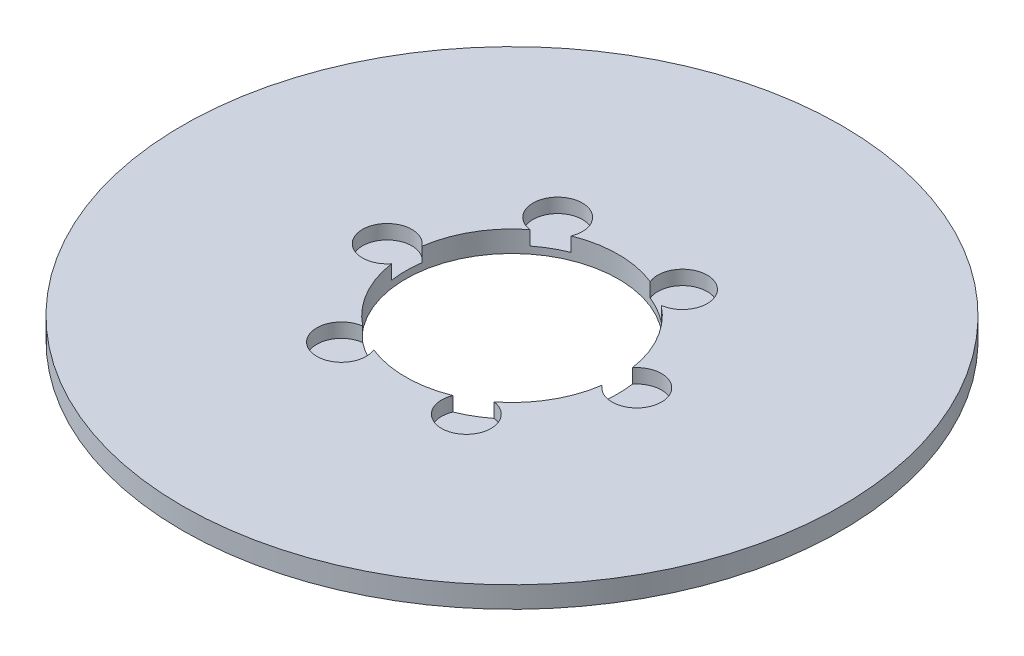
from build123d import *

# Parameters (mm, degrees)
SKETCH1_R           = 77.5
BOSS_EXTRUDE1_DEPTH = 5
SKETCH2_R           = 25
CUT_EXTRUDE1_DEPTH  = 110.715541287
SKETCH3_R           = 5.816818437
CUT_EXTRUDE2_DEPTH  = 3.356195956
CIRPATTERN1_COUNT   = 6


with BuildPart() as part:
    # Sketch1 → Boss-Extrude1 (new body)
    with BuildSketch(Plane(origin=(0, 0, 0), x_dir=(1, 0, 0), z_dir=(0, 1, 0))):
        Circle(SKETCH1_R)
    extrude(amount=BOSS_EXTRUDE1_DEPTH)

    # Sketch2 → Cut-Extrude1 (cut, through all)
    with BuildSketch(Plane(origin=(0, 0, 0), x_dir=(1, 0, 0), z_dir=(0, 1, 0))):
        Circle(SKETCH2_R)
    extrude(amount=CUT_EXTRUDE1_DEPTH, mode=Mode.SUBTRACT)

    # Sketch3 → Cut-Extrude2 (cut)
    with BuildSketch(Plane(origin=(0, 5, 0), x_dir=(1, 0, 0), z_dir=(0, 1, 0))):
        with Locations((-29.350622892, 0)):
            Circle(SKETCH3_R)
    cut_extrude2 = extrude(amount=-CUT_EXTRUDE2_DEPTH, mode=Mode.SUBTRACT)

    # CirPattern1: Cut-Extrude2 ×6 about axis
    cirpattern1_axis = Axis((0, 0, 0), (0, 1, 0))
    for i in range(1, CIRPATTERN1_COUNT):
        add(cut_extrude2.rotate(cirpattern1_axis, i * 360 / CIRPATTERN1_COUNT), mode=Mode.SUBTRACT)


solid = part.part
